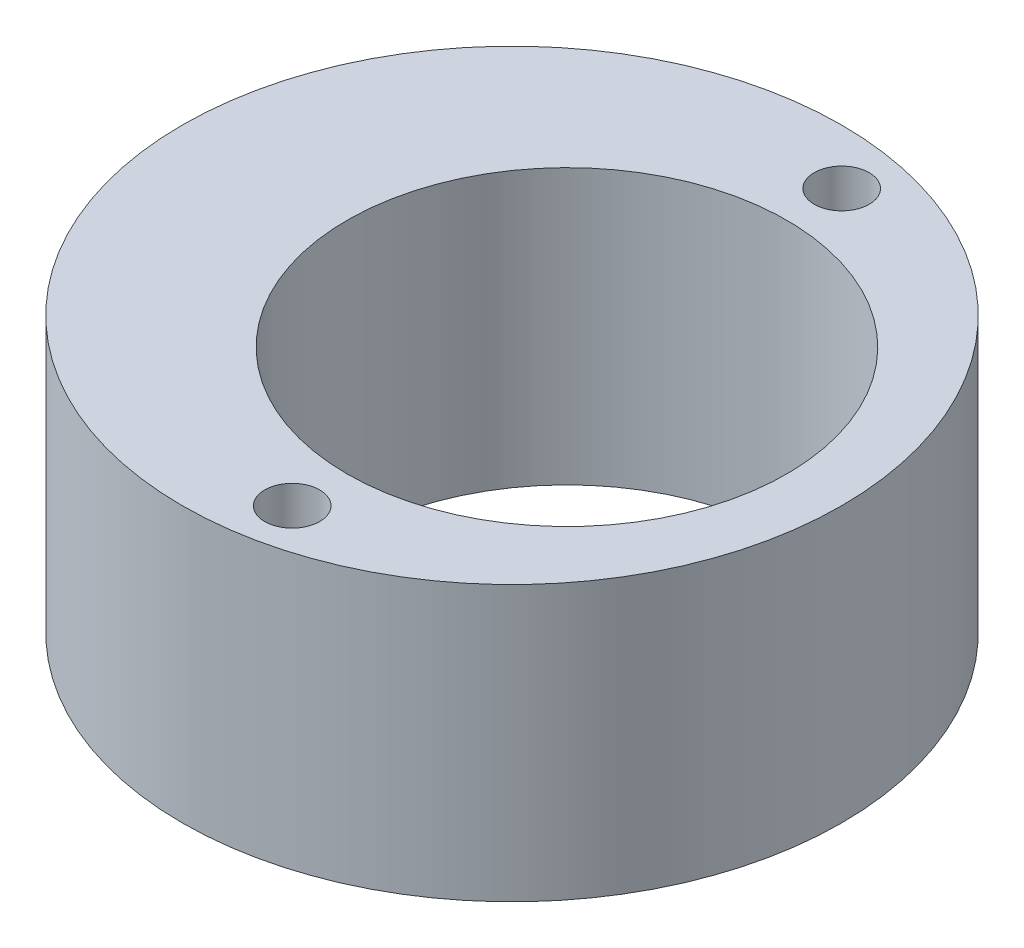
from build123d import *

# Parameters (mm, degrees)
SKETCH1_R           = 6
SKETCH1_R_2         = 4
SKETCH1_R_3         = 0.5
BOSS_EXTRUDE1_DEPTH = 5


with BuildPart() as part:
    # Sketch1 → Boss-Extrude1 (new body)
    with BuildSketch(Plane(origin=(0, 0, 0), x_dir=(1, 0, 0), z_dir=(0, 1, 0))):
        with Locations((-1, 0)):
            Circle(SKETCH1_R)
        Circle(SKETCH1_R_2, mode=Mode.SUBTRACT)
        with Locations((0, 5)):
            Circle(SKETCH1_R_3, mode=Mode.SUBTRACT)
        with Locations((0, -5)):
            Circle(SKETCH1_R_3, mode=Mode.SUBTRACT)
    extrude(amount=BOSS_EXTRUDE1_DEPTH)


solid = part.part
